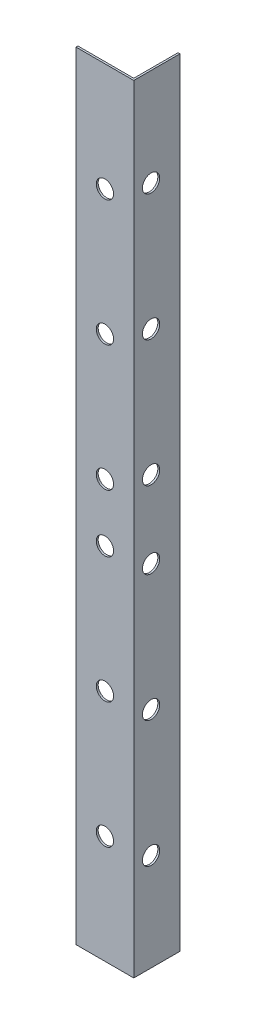
from build123d import *

# Parameters (mm, degrees)
BOSS_EXTRUDE1_DEPTH = 202
CUT_EXTRUDE1_REACH  = 204.911
SKETCH2_R           = 2.25
CUT_EXTRUDE2_REACH  = 204.911
SKETCH3_R           = 2.25


with BuildPart() as part:
    # Sketch1 → Boss-Extrude1 (new body)
    with BuildSketch(Plane(origin=(0, 0, 0), x_dir=(1, 0, 0), z_dir=(0, 1, 0))):
        Polygon((0, 0), (15, 0), (15, 12), (14.5, 12), (14.5, 0.5), (0, 0.5), align=None)
    extrude(amount=BOSS_EXTRUDE1_DEPTH)

    # Sketch2 → Cut-Extrude1 (cut, up to next)
    with BuildSketch(Plane.XY, mode=Mode.PRIVATE) as cut_extrude1_sk1:
        with Locations((7.5, 173.833333333)):
            Circle(SKETCH2_R)
    cut_extrude1_tool1 = extrude(cut_extrude1_sk1.sketch, amount=-CUT_EXTRUDE1_REACH, mode=Mode.PRIVATE) & part.part
    # Sketch2 → Cut-Extrude1 (cut, up to next)
    with BuildSketch(Plane.XY, mode=Mode.PRIVATE) as cut_extrude1_sk2:
        with Locations((7.5, 141.166666667)):
            Circle(SKETCH2_R)
    cut_extrude1_tool2 = extrude(cut_extrude1_sk2.sketch, amount=-CUT_EXTRUDE1_REACH, mode=Mode.PRIVATE) & part.part
    # Sketch2 → Cut-Extrude1 (cut, up to next)
    with BuildSketch(Plane.XY, mode=Mode.PRIVATE) as cut_extrude1_sk3:
        with Locations((7.5, 108.5)):
            Circle(SKETCH2_R)
    cut_extrude1_tool3 = extrude(cut_extrude1_sk3.sketch, amount=-CUT_EXTRUDE1_REACH, mode=Mode.PRIVATE) & part.part
    # Sketch2 → Cut-Extrude1 (cut, up to next)
    with BuildSketch(Plane.XY, mode=Mode.PRIVATE) as cut_extrude1_sk4:
        with Locations((7.5, 93.5)):
            Circle(SKETCH2_R)
    cut_extrude1_tool4 = extrude(cut_extrude1_sk4.sketch, amount=-CUT_EXTRUDE1_REACH, mode=Mode.PRIVATE) & part.part
    # Sketch2 → Cut-Extrude1 (cut, up to next)
    with BuildSketch(Plane.XY, mode=Mode.PRIVATE) as cut_extrude1_sk5:
        with Locations((7.5, 60.833333333)):
            Circle(SKETCH2_R)
    cut_extrude1_tool5 = extrude(cut_extrude1_sk5.sketch, amount=-CUT_EXTRUDE1_REACH, mode=Mode.PRIVATE) & part.part
    # Sketch2 → Cut-Extrude1 (cut, up to next)
    with BuildSketch(Plane.XY, mode=Mode.PRIVATE) as cut_extrude1_sk6:
        with Locations((7.5, 28.166666667)):
            Circle(SKETCH2_R)
    cut_extrude1_tool6 = extrude(cut_extrude1_sk6.sketch, amount=-CUT_EXTRUDE1_REACH, mode=Mode.PRIVATE) & part.part
    add(cut_extrude1_tool1.solids().sort_by_distance((7.5, 173.833333, 0))[0], mode=Mode.SUBTRACT)
    add(cut_extrude1_tool2.solids().sort_by_distance((7.5, 141.166667, 0))[0], mode=Mode.SUBTRACT)
    add(cut_extrude1_tool3.solids().sort_by_distance((7.5, 108.5, 0))[0], mode=Mode.SUBTRACT)
    add(cut_extrude1_tool4.solids().sort_by_distance((7.5, 93.5, 0))[0], mode=Mode.SUBTRACT)
    add(cut_extrude1_tool5.solids().sort_by_distance((7.5, 60.833333, 0))[0], mode=Mode.SUBTRACT)
    add(cut_extrude1_tool6.solids().sort_by_distance((7.5, 28.166667, 0))[0], mode=Mode.SUBTRACT)

    # Sketch3 → Cut-Extrude2 (cut, up to next)
    with BuildSketch(Plane(origin=(15, 0, 0), x_dir=(0, 0, -1), z_dir=(1, 0, 0)), mode=Mode.PRIVATE) as cut_extrude2_sk1:
        with Locations((4.5, 25.333333333)):
            Circle(SKETCH3_R)
    cut_extrude2_tool1 = extrude(cut_extrude2_sk1.sketch, amount=-CUT_EXTRUDE2_REACH, mode=Mode.PRIVATE) & part.part
    # Sketch3 → Cut-Extrude2 (cut, up to next)
    with BuildSketch(Plane(origin=(15, 0, 0), x_dir=(0, 0, -1), z_dir=(1, 0, 0)), mode=Mode.PRIVATE) as cut_extrude2_sk2:
        with Locations((4.5, 58.166666667)):
            Circle(SKETCH3_R)
    cut_extrude2_tool2 = extrude(cut_extrude2_sk2.sketch, amount=-CUT_EXTRUDE2_REACH, mode=Mode.PRIVATE) & part.part
    # Sketch3 → Cut-Extrude2 (cut, up to next)
    with BuildSketch(Plane(origin=(15, 0, 0), x_dir=(0, 0, -1), z_dir=(1, 0, 0)), mode=Mode.PRIVATE) as cut_extrude2_sk3:
        with Locations((4.5, 91)):
            Circle(SKETCH3_R)
    cut_extrude2_tool3 = extrude(cut_extrude2_sk3.sketch, amount=-CUT_EXTRUDE2_REACH, mode=Mode.PRIVATE) & part.part
    # Sketch3 → Cut-Extrude2 (cut, up to next)
    with BuildSketch(Plane(origin=(15, 0, 0), x_dir=(0, 0, -1), z_dir=(1, 0, 0)), mode=Mode.PRIVATE) as cut_extrude2_sk4:
        with Locations((4.5, 111)):
            Circle(SKETCH3_R)
    cut_extrude2_tool4 = extrude(cut_extrude2_sk4.sketch, amount=-CUT_EXTRUDE2_REACH, mode=Mode.PRIVATE) & part.part
    # Sketch3 → Cut-Extrude2 (cut, up to next)
    with BuildSketch(Plane(origin=(15, 0, 0), x_dir=(0, 0, -1), z_dir=(1, 0, 0)), mode=Mode.PRIVATE) as cut_extrude2_sk5:
        with Locations((4.5, 143.833333333)):
            Circle(SKETCH3_R)
    cut_extrude2_tool5 = extrude(cut_extrude2_sk5.sketch, amount=-CUT_EXTRUDE2_REACH, mode=Mode.PRIVATE) & part.part
    # Sketch3 → Cut-Extrude2 (cut, up to next)
    with BuildSketch(Plane(origin=(15, 0, 0), x_dir=(0, 0, -1), z_dir=(1, 0, 0)), mode=Mode.PRIVATE) as cut_extrude2_sk6:
        with Locations((4.5, 176.666666667)):
            Circle(SKETCH3_R)
    cut_extrude2_tool6 = extrude(cut_extrude2_sk6.sketch, amount=-CUT_EXTRUDE2_REACH, mode=Mode.PRIVATE) & part.part
    add(cut_extrude2_tool1.solids().sort_by_distance((15, 25.333333, -4.5))[0], mode=Mode.SUBTRACT)
    add(cut_extrude2_tool2.solids().sort_by_distance((15, 58.166667, -4.5))[0], mode=Mode.SUBTRACT)
    add(cut_extrude2_tool3.solids().sort_by_distance((15, 91, -4.5))[0], mode=Mode.SUBTRACT)
    add(cut_extrude2_tool4.solids().sort_by_distance((15, 111, -4.5))[0], mode=Mode.SUBTRACT)
    add(cut_extrude2_tool5.solids().sort_by_distance((15, 143.833333, -4.5))[0], mode=Mode.SUBTRACT)
    add(cut_extrude2_tool6.solids().sort_by_distance((15, 176.666667, -4.5))[0], mode=Mode.SUBTRACT)


solid = part.part
